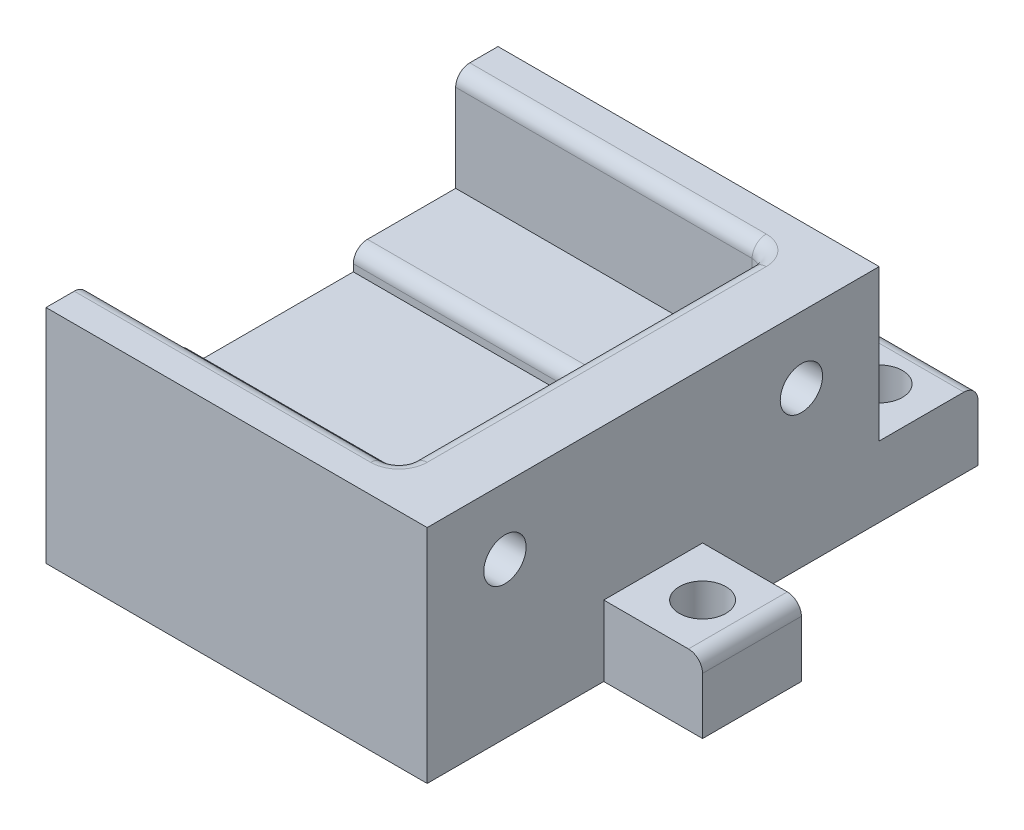
from build123d import *

# Parameters (mm, degrees)
BOSS_EXTRUDE1_DEPTH = 11
SKETCH3_W           = 22
SKETCH3_H           = 3
BOSS_EXTRUDE2_DEPTH = 15.7
BOSS_EXTRUDE3_DEPTH = 5
SKETCH5_R           = 1.5
CUT_EXTRUDE1_DEPTH  = 36.096650541
SKETCH6_W           = 7
SKETCH6_H           = 7
BOSS_EXTRUDE4_DEPTH = 5
SKETCH7_R           = 1.65
CUT_EXTRUDE2_DEPTH  = 35.247620052
FILLET1_R           = 1


with BuildPart() as part:
    # Sketch1 → Boss-Extrude1 (new, symmetric)
    with BuildSketch(Plane(origin=(0, 0, 0), x_dir=(0, 0, -1), z_dir=(1, 0, 0))):
        Polygon((-13.0089, 0), (13.0089, 0), (13.0089, 8.5), (5.7589, 8.5), (5.7589, 7), (-5.7589, 7), (-5.7589, 8.5), (-13.0089, 8.5), align=None)
    extrude(amount=BOSS_EXTRUDE1_DEPTH, both=True)

    # Sketch3 → Boss-Extrude2 (add)
    with BuildSketch(Plane.XZ):
        with Locations((0, -14.5089)):
            Rectangle(SKETCH3_W, SKETCH3_H)
        with Locations((0, 14.5089)):
            Rectangle(SKETCH3_W, SKETCH3_H)
    extrude(amount=-BOSS_EXTRUDE2_DEPTH)

    # Sketch4 → Boss-Extrude3 (add)
    with BuildSketch(Plane(origin=(11, 0, 0), x_dir=(0, 0, -1), z_dir=(1, 0, 0))):
        Polygon((-8.8, 15.7), (-16.0089, 15.7), (-16.0089, 0), (16.0089, 0), (16.0089, 15.7), align=None)
    extrude(amount=BOSS_EXTRUDE3_DEPTH)

    # Sketch5 → Cut-Extrude1 (cut, through all)
    with BuildSketch(Plane(origin=(16, 0, 0), x_dir=(0, 0, -1), z_dir=(1, 0, 0))):
        with Locations((-10.5, 11)):
            Circle(SKETCH5_R)
        with Locations((10.5, 11)):
            Circle(SKETCH5_R)
    extrude(amount=-CUT_EXTRUDE1_DEPTH, mode=Mode.SUBTRACT)

    # Sketch6 → Boss-Extrude4 (add)
    with BuildSketch(Plane.XZ):
        with Locations((19.5, 0)):
            Rectangle(SKETCH6_W, SKETCH6_H)
        with Locations((12.5, -19.5089)):
            Rectangle(SKETCH6_W, SKETCH6_H)
    extrude(amount=-BOSS_EXTRUDE4_DEPTH)

    # Sketch7 → Cut-Extrude2 (cut, through all)
    with BuildSketch(Plane(origin=(0, 5, 0), x_dir=(1, 0, 0), z_dir=(0, 1, 0))):
        with Locations((19.5, 0)):
            Circle(SKETCH7_R)
        with Locations((12.5, 19.5089)):
            Circle(SKETCH7_R)
    extrude(amount=-CUT_EXTRUDE2_DEPTH, mode=Mode.SUBTRACT)

    # Fillet1
    fillet1_edges = [part.edges().sort_by_distance(p)[0] for p in [
        (0, 8.5, 5.7589),
        (0, 8.5, -5.7589),
        (23, 5, 0),
        (12.5, 5, -23.0089),
        (0, 15.7, 13.0089),
        (11, 15.7, 0),
        (0, 15.7, -13.0089),
        (11, 12.1, 13.0089),
        (11, 12.1, -13.0089),
    ]]
    fillet(fillet1_edges, radius=FILLET1_R)


solid = part.part
